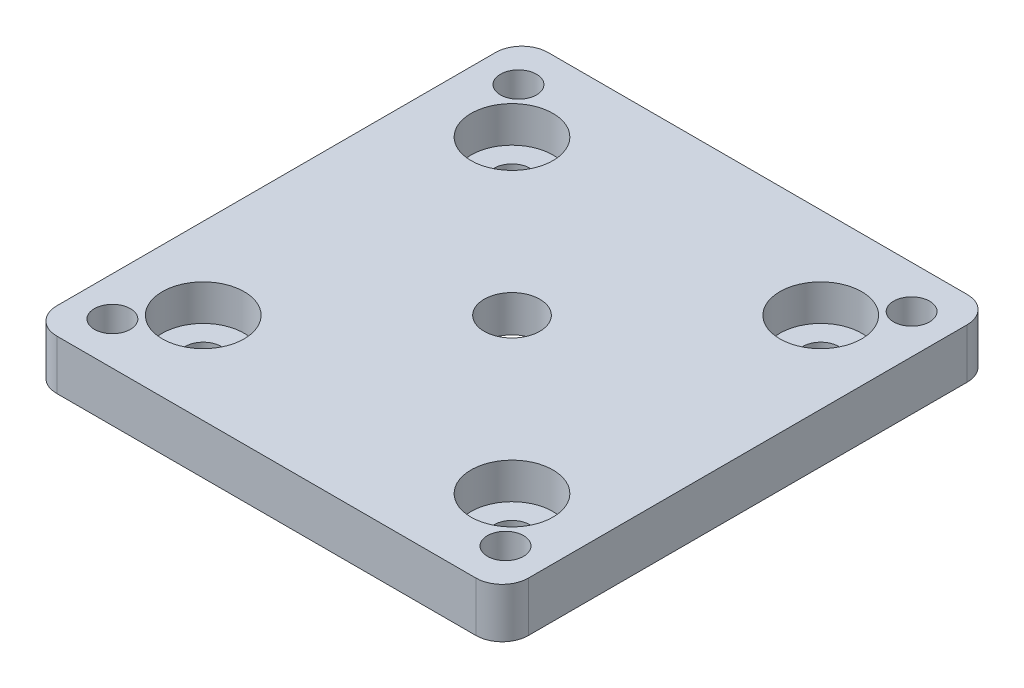
from build123d import *

# Parameters (mm, degrees)
SKETCH1_W           = 72
SKETCH1_H           = 75
SKETCH1_R           = 2.75
SKETCH1_R_2         = 4.25
BOSS_EXTRUDE3_DEPTH = 7.6
SKETCH3_R           = 6.25
CUT_EXTRUDE1_DEPTH  = 5.5
FILLET1_R           = 4
SKETCH4_R           = 19.3
CUT_EXTRUDE2_DEPTH  = 2


with BuildPart() as part:
    # Sketch1 → Boss-Extrude3 (new body)
    with BuildSketch(Plane(origin=(0, 0, 0), x_dir=(1, 0, 0), z_dir=(0, 1, 0))):
        with Locations((30.01, -31)):
            Rectangle(SKETCH1_W, SKETCH1_H)
        with Locations((60.02, 0)):
            Circle(SKETCH1_R, mode=Mode.SUBTRACT)
        with Locations((60.02, -62)):
            Circle(SKETCH1_R, mode=Mode.SUBTRACT)
        with Locations((0, -62)):
            Circle(SKETCH1_R, mode=Mode.SUBTRACT)
        Circle(SKETCH1_R, mode=Mode.SUBTRACT)
        with Locations((6.44, -7.43)):
            Circle(SKETCH1_R, mode=Mode.SUBTRACT)
        with Locations((6.44, -54.57)):
            Circle(SKETCH1_R, mode=Mode.SUBTRACT)
        with Locations((53.58, -54.57)):
            Circle(SKETCH1_R, mode=Mode.SUBTRACT)
        with Locations((53.58, -7.43)):
            Circle(SKETCH1_R, mode=Mode.SUBTRACT)
        with Locations((30.01, -31)):
            Circle(SKETCH1_R_2, mode=Mode.SUBTRACT)
    extrude(amount=BOSS_EXTRUDE3_DEPTH)

    # Sketch3 → Cut-Extrude1 (cut)
    with BuildSketch(Plane(origin=(0, 7.6, 0), x_dir=(1, 0, 0), z_dir=(0, 1, 0))):
        with Locations((6.44, -7.43)):
            Circle(SKETCH3_R)
        with Locations((53.58, -7.43)):
            Circle(SKETCH3_R)
        with Locations((53.58, -54.57)):
            Circle(SKETCH3_R)
        with Locations((6.44, -54.57)):
            Circle(SKETCH3_R)
    extrude(amount=-CUT_EXTRUDE1_DEPTH, mode=Mode.SUBTRACT)

    # Fillet1
    fillet1_edges = [part.edges().sort_by_distance(p)[0] for p in [
        (-5.99, 3.8, 68.5),
        (66.01, 3.8, 68.5),
        (66.01, 3.8, -6.5),
        (-5.99, 3.8, -6.5),
    ]]
    fillet(fillet1_edges, radius=FILLET1_R)

    # Sketch4 → Cut-Extrude2 (cut)
    with BuildSketch(Plane.XZ):
        with Locations((30.01, 31)):
            Circle(SKETCH4_R)
    extrude(amount=-CUT_EXTRUDE2_DEPTH, mode=Mode.SUBTRACT)


solid = part.part
